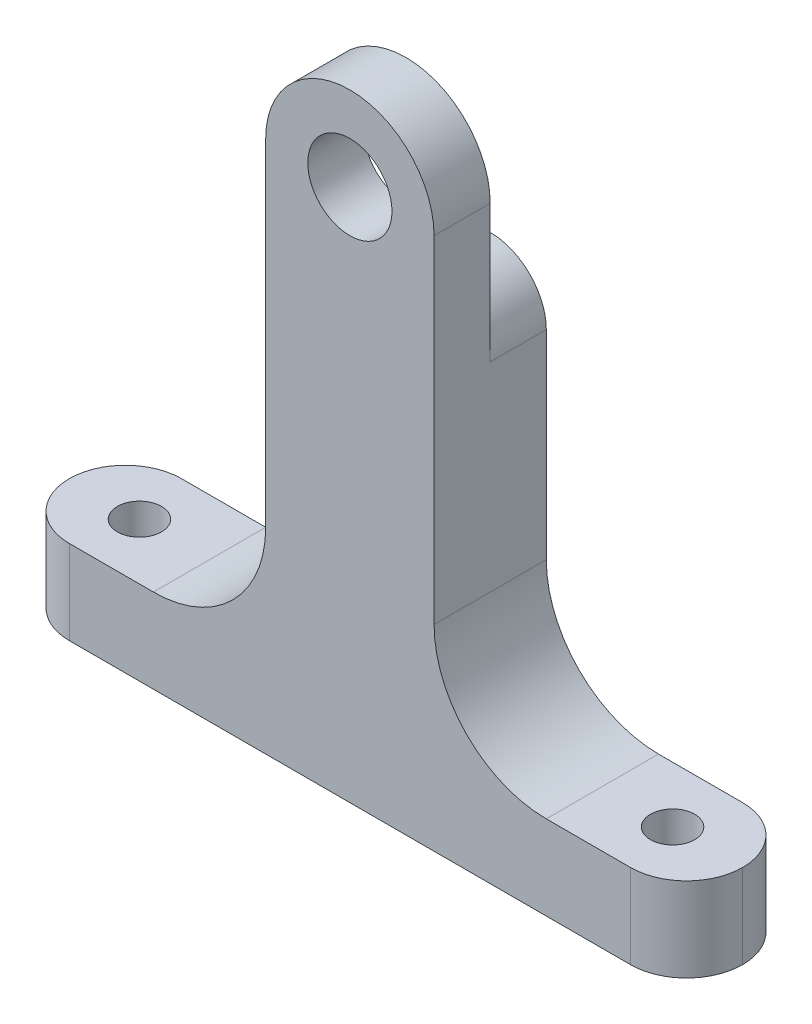
from build123d import *

# Parameters (mm, degrees)
SKETCH2_R           = 9.525
SKETCH2_R_2         = 4.7625
BOSS_EXTRUDE1_DEPTH = 12.7
FILLET1_R           = 12.7
SKETCH3_R           = 2.5
CUT_EXTRUDE1_DEPTH  = 35.56
FILLET2_R           = 6.35
SKETCH4_R           = 4.7625
CUT_EXTRUDE2_DEPTH  = 6.35
FILLET3_START       = -1
FILLET3_DEPTH       = 7.35


with BuildPart() as part:
    # Sketch2 → Boss-Extrude1 (new body)
    # profile 1 of 2: a face of its own
    with BuildSketch(Plane.XY):
        with BuildLine():
            ThreePointArc((9.525, 0), (0, -9.525), (-9.525, 0))
            Line((-9.525, 0), (-9.525, -50.8))
            Line((-9.525, -50.8), (-38.1, -50.8))
            Line((-38.1, -50.8), (-38.1, -60.325))
            Line((-38.1, -60.325), (38.1, -60.325))
            Line((38.1, -60.325), (38.1, -50.8))
            Line((38.1, -50.8), (9.525, -50.8))
            Line((9.525, -50.8), (9.525, 0))
        make_face()
    # profile 2 of 2: a face of its own
    with BuildSketch(Plane.XY):
        Circle(SKETCH2_R)
        Circle(SKETCH2_R_2, mode=Mode.SUBTRACT)
    extrude(amount=BOSS_EXTRUDE1_DEPTH)

    # Fillet1
    fillet1_edges = [part.edges().sort_by_distance(p)[0] for p in [
        (9.525, -50.8, 6.35),
        (-9.525, -50.8, 6.35),
    ]]
    fillet(fillet1_edges, radius=FILLET1_R)

    # Sketch3 → Cut-Extrude1 (cut)
    with BuildSketch(Plane(origin=(0, -50.8, 0), x_dir=(1, 0, 0), z_dir=(0, 1, 0))):
        with Locations(Location((30.1625, -6.35, 0), (0, 0, 180))):
            Circle(SKETCH3_R)
        with Locations(Location((-30.1625, -6.35, 0), (0, 0, 180))):
            Circle(SKETCH3_R)
    extrude(amount=-CUT_EXTRUDE1_DEPTH, mode=Mode.SUBTRACT)

    # Fillet2
    fillet2_edges = [part.edges().sort_by_distance(p)[0] for p in [
        (38.1, -55.5625, 0),
        (38.1, -55.5625, 12.7),
        (-38.1, -55.5625, 0),
        (-38.1, -55.5625, 12.7),
    ]]
    fillet(fillet2_edges, radius=FILLET2_R - 0.0001)  # a hair under: the kernel refuses the full size

    # Sketch4 → Cut-Extrude2 (cut)
    with BuildSketch(Plane(origin=(0, 0, 0), x_dir=(-1, 0, 0), z_dir=(0, 0, -1))):
        with BuildLine():
            ThreePointArc((-9.525, 0), (0, -9.525), (9.525, 0))
            ThreePointArc((9.525, 0), (0, 9.525), (-9.525, 0))
        make_face()
        with Locations(Location((0, 0, 0), (0, 0, 180))):
            Circle(SKETCH4_R, mode=Mode.SUBTRACT)
    extrude(amount=-CUT_EXTRUDE2_DEPTH, mode=Mode.SUBTRACT)

    # Fillet3: read off the stored shape, not the designer's step
    # Fillet3 outline → Fillet3 (cut)
    with BuildSketch(Plane.XY.offset(FILLET3_START)):
        with BuildLine():
            Line((-9.525, 0), (-9.525, -15.554259867))
            ThreePointArc((-9.525, -15.554259867), (-7.191092628, -10.635571017), (-1.905, -9.33255592))
            ThreePointArc((-1.905, -9.33255592), (-7.378033275, -6.024138943), (-9.525, 0))
        make_face()
        with BuildLine():
            ThreePointArc((9.525, 0), (7.378033275, -6.024138943), (1.905, -9.33255592))
            ThreePointArc((1.905, -9.33255592), (7.191092628, -10.635571017), (9.525, -15.554259867))
            Line((9.525, -15.554259867), (9.525, 0))
        make_face()
    extrude(amount=FILLET3_DEPTH, mode=Mode.SUBTRACT)


solid = part.part
